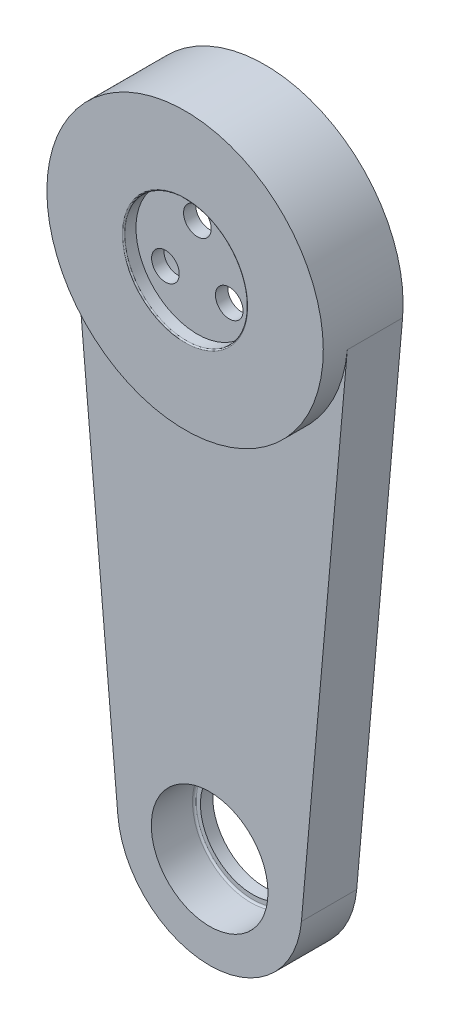
from build123d import *

# Parameters (mm, degrees)
SKETCH_2_R                   = 22.5
EXTRUDE_2_DEPTH              = 2
SKETCH_22_R                  = 10
CUT_EXTRUDE_1_DEPTH          = 2
FILLET_4_R                   = 0.2
SKETCH_54_R                  = 22.5
EXTRUDE_6_DEPTH              = 11
SKETCH_55_R                  = 18.5
CUT_EXTRUDE_2_DEPTH          = 8
HOLE_WIZARD_M4_1_D           = 4.5
HOLE_WIZARD_M4_1_CBORE_D     = 8
HOLE_WIZARD_M4_1_CBORE_DEPTH = 1
PATTERN_CIRCULAR_1_COUNT     = 3
EXTRUDE_START                = 1
SKETCH_59_R                  = 18.5
SKETCH_59_R_2                = 17.5
EXTRUDE_7_DEPTH              = 1
EXTRUDE_START_2              = -9
EXTRUDE_8_DEPTH              = 9
FILLET_6_R                   = 0.3
SKETCH_68_R                  = 9.5
CUT_EXTRUDE_7_DEPTH          = 7
SKETCH_69_R                  = 8.5
CUT_EXTRUDE_8_DEPTH          = 104.088554166
FILLET_7_R                   = 0.3


with BuildPart() as part:
    # 스케치2 → 보스-돌출2 (new body)
    with BuildSketch(Plane(origin=(0, 6, 0), x_dir=(1, 0, 0), z_dir=(0, 0, -1))):
        with Locations((0, 6)):
            Circle(SKETCH_2_R)
    extrude(amount=EXTRUDE_2_DEPTH)

    # 스케치22 → 컷-돌출1 (cut)
    with BuildSketch(Plane.XY):
        Circle(SKETCH_22_R)
    extrude(amount=-CUT_EXTRUDE_1_DEPTH, mode=Mode.SUBTRACT)

    # 필렛4
    fillet_4_edges = [part.edges().sort_by_distance(p)[0] for p in [
        (-10, 0, 0),
    ]]
    fillet(fillet_4_edges, radius=FILLET_4_R)

    # 스케치54 → 보스-돌출6 (add)
    with BuildSketch(Plane(origin=(0, 0, -2), x_dir=(-1, 0, 0), z_dir=(0, 0, -1))):
        Circle(SKETCH_54_R)
    extrude(amount=EXTRUDE_6_DEPTH)

    # 스케치55 → 컷-돌출2 (cut)
    with BuildSketch(Plane(origin=(0, 0, -13), x_dir=(-1, 0, 0), z_dir=(0, 0, -1))):
        Circle(SKETCH_55_R)
    extrude(amount=-CUT_EXTRUDE_2_DEPTH, mode=Mode.SUBTRACT)

    # M4 육각 소켓 머리 캡 나사용 카운터보어1 (through all)
    with Locations(Plane(origin=(0, 0, -5), x_dir=(-1, 0, 0), z_dir=(0, 0, -1))):
        with Locations((0, 6)):
            hole_wizard_m4_1 = CounterBoreHole(HOLE_WIZARD_M4_1_D / 2, HOLE_WIZARD_M4_1_CBORE_D / 2, HOLE_WIZARD_M4_1_CBORE_DEPTH)

    # 원형 패턴1: M4 육각 소켓 머리 캡 나사용 카운터보어1 ×3 about axis
    pattern_circular_1_axis = Axis((0, 0, -2), (0, 0, 1))
    for i in range(1, PATTERN_CIRCULAR_1_COUNT):
        add(hole_wizard_m4_1.rotate(pattern_circular_1_axis, i * 360 / PATTERN_CIRCULAR_1_COUNT), mode=Mode.SUBTRACT)

    # 스케치59 → 보스-돌출7 (add)
    with BuildSketch(Plane(origin=(0, 0, -5), x_dir=(-1, 0, 0), z_dir=(0, 0, -1)).offset(EXTRUDE_START)):
        Circle(SKETCH_59_R)
        Circle(SKETCH_59_R_2, mode=Mode.SUBTRACT)
    extrude(amount=-EXTRUDE_7_DEPTH)

    # 스케치60 → 보스-돌출8 (add)
    with BuildSketch(Plane(origin=(0, 0, -13), x_dir=(-1, 0, 0), z_dir=(0, 0, -1)).offset(EXTRUDE_START_2)):
        with BuildLine():
            Line((-22.412242352, -1.985294118), (-14.941494902, -86.323529412))
            ThreePointArc((-14.941494902, -86.323529412), (0, -100), (14.941494902, -86.323529412))
            Line((14.941494902, -86.323529412), (22.412242352, -1.985294118))
            ThreePointArc((22.412242352, -1.985294118), (0, -22.5), (-22.412242352, -1.985294118))
        make_face()
    extrude(amount=EXTRUDE_8_DEPTH)

    # 필렛6
    fillet_6_edges = [part.edges().sort_by_distance(p)[0] for p in [
        (18.5, 0, -6),
    ]]
    fillet(fillet_6_edges, radius=FILLET_6_R)

    # 스케치68 → 컷-돌출7 (cut)
    with BuildSketch(Plane.XY.offset(-4)):
        with Locations((0, -85)):
            Circle(SKETCH_68_R)
    extrude(amount=-CUT_EXTRUDE_7_DEPTH, mode=Mode.SUBTRACT)

    # 스케치69 → 컷-돌출8 (cut, through all)
    with BuildSketch(Plane.XY.offset(-11)):
        with Locations((0, -85)):
            Circle(SKETCH_69_R)
    extrude(amount=-CUT_EXTRUDE_8_DEPTH, mode=Mode.SUBTRACT)

    # 필렛7
    fillet_7_edges = [part.edges().sort_by_distance(p)[0] for p in [
        (-9.5, -85, -11),
    ]]
    fillet(fillet_7_edges, radius=FILLET_7_R)


solid = part.part
